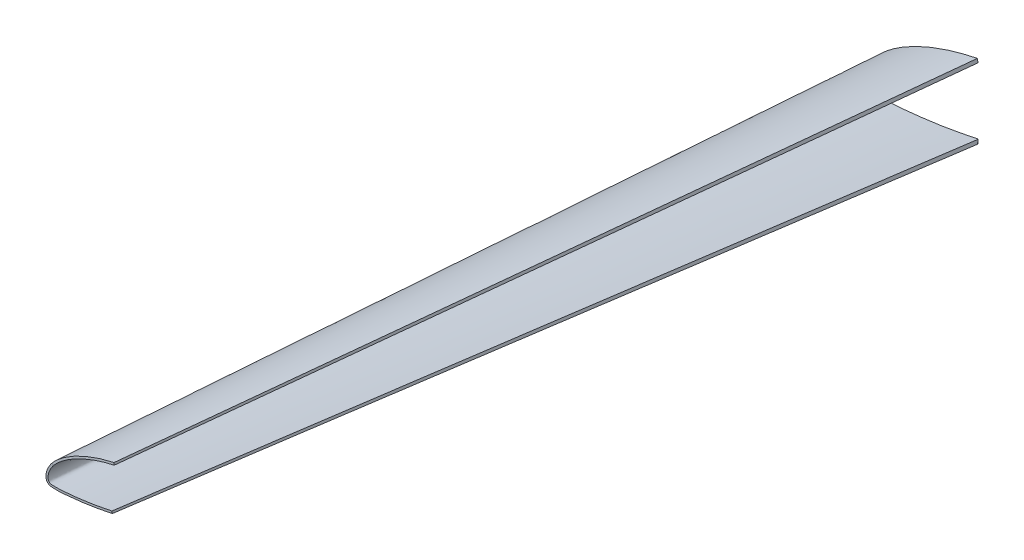
from build123d import *

# Parameters (mm, degrees)
CUT_EXTRUDE5_DEPTH      = 467.171820203
CUT_EXTRUDE5_DEPTH_BACK = 467.171820203


with BuildPart() as part:
    # Boundary1: read off the stored shape, not the designer's step
    # Boundary1: loft between two sections, ruled curve by curve
    boundary1_from = [
        Edge.make_bspline([(27.746461368, -10.231582557, -0.37970371), (24.54048865, -10.88648923, -0.3224068), (18.322219711, -12.153767625, -0.211534307), (9.311879161, -13.768668652, -0.070248775), (0.965035467, -14.962763473, 0.034220985), (-6.604009298, -15.908371944, 0.116951007), (-13.358041741, -16.623063146, 0.179478385), (-19.228055617, -17.091792561, 0.220486895), (-24.147885132, -17.37038488, 0.244860564), (-28.064249619, -17.286606019, 0.237530864), (-30.927663742, -17.184111401, 0.228563747), (-33.069779251, -16.204477975, 0.142856927), (-33.670245564, -14.180380357, -0.034228668), (-33.79784861, -11.966277347, -0.227937581), (-33.330465654, -9.339970934, -0.457709619), (-32.313062195, -6.487599721, -0.707259765), (-30.705815178, -3.476068737, -0.970734586), (-28.516579872, -0.373222201, -1.242198482), (-25.653586837, 2.727393202, -1.51346718), (-22.130293772, 5.79908064, -1.782205009), (-17.998850338, 8.874134437, -2.051237356), (-13.260099319, 11.888557643, -2.314965213), (-7.943462931, 14.801976598, -2.569856344), (-2.077633941, 17.581693253, -2.813050039), (4.319210231, 20.172647346, -3.03972915), (11.207289388, 22.560882395, -3.248672642), (19.047405598, 24.834293744, -3.447570363), (24.631685242, 26.123911427, -3.560397291), (27.746461368, 26.733720257, -3.61374865)], [0, 0, 0, 0, 0.069142211, 0.134093926, 0.193382849, 0.247272805, 0.29525533, 0.336863889, 0.371680257, 0.39933975, 0.419456898, 0.432512713, 0.445408835, 0.461295234, 0.479930086, 0.501308052, 0.525350586, 0.552013073, 0.581539338, 0.614461538, 0.650800476, 0.69040154, 0.733149242, 0.778919637, 0.827558387, 0.878968086, 0.932940996, 1, 1, 1, 1], 3),
        Edge.make_bspline([(27.360981111, 28.687716483, -3.784701168), (24.418912176, 28.111720153, -3.734308019), (18.568950334, 26.774993221, -3.617359566), (9.931603873, 24.271530826, -3.398334987), (1.454173497, 21.248858509, -3.133885426), (-6.825266824, 17.649092208, -2.818946683), (-13.476961936, 14.097742153, -2.508243813), (-18.595650936, 10.855460073, -2.224580887), (-22.295577191, 8.189990235, -1.991382494), (-25.829788091, 5.2796825, -1.736763559), (-29.147742681, 1.998580964, -1.449704371), (-31.555461477, -1.135032916, -1.175548681), (-33.181527352, -3.844071716, -0.938538497), (-34.240367025, -6.002821132, -0.749672395), (-35.079614705, -8.291167612, -0.54946802), (-35.557667228, -10.322301427, -0.371766837), (-35.732624245, -12.044184646, -0.221121576), (-35.721862376, -13.37712306, -0.104504575), (-35.582262474, -14.479538884, -0.008055688), (-35.368251029, -15.436490393, 0.07566672), (-35.0906666, -16.242838807, 0.146213065), (-34.612779787, -17.109226433, 0.222012161), (-33.836646855, -17.896788857, 0.290914945), (-33.042092756, -18.3852358, 0.333648515), (-32.003372281, -18.824617033, 0.372089392), (-30.818177722, -19.102451519, 0.39639676), (-29.490238689, -19.231378803, 0.407676436), (-28.340965262, -19.26258139, 0.410406308), (-26.85641179, -19.303547365, 0.413990367), (-24.952158992, -19.327749266, 0.416107759), (-22.656109383, -19.271609205, 0.41119614), (-20.398107438, -19.14823427, 0.400402231), (-18.167525907, -18.995496212, 0.387039383), (-15.192679466, -18.766498595, 0.367004687), (-11.479797979, -18.427372101, 0.337334964), (-7.040502934, -17.948902242, 0.295474275), (-2.6127621, -17.418521591, 0.249071981), (3.278252149, -16.651200192, 0.181940057), (10.649779589, -15.568979876, 0.087258048), (19.442358508, -13.958032163, -0.053681614), (25.243200231, -12.775750709, -0.157117839), (28.148011567, -12.182364396, -0.209032414)], [0, 0, 0, 0, 0.0625, 0.125, 0.1875, 0.25, 0.3125, 0.34375, 0.375, 0.40625, 0.4375, 0.46875, 0.484375, 0.5, 0.515625, 0.53125, 0.5390625, 0.546875, 0.5546875, 0.55859375, 0.5625, 0.56640625, 0.5703125, 0.57421875, 0.578125, 0.5859375, 0.59375, 0.6015625, 0.609375, 0.625, 0.640625, 0.65625, 0.671875, 0.6875, 0.71875, 0.75, 0.78125, 0.8125, 0.875, 0.9375, 1, 1, 1, 1], 3),
        Edge.make_line((28.148011567, -12.182364396, -0.209032414), (27.746461368, -10.231582557, -0.37970371)),
        Edge.make_line((27.746461368, 26.733720257, -3.61374865), (27.360981111, 28.687716483, -3.784701168)),
    ]
    boundary1_to = [
        Edge.make_bspline([(1.183457689, 25.927911818, 461.777436147), (-0.686693063, 25.545882925, 461.810859344), (-4.314016611, 24.806637194, 461.875534965), (-9.570048598, 23.864611595, 461.957951526), (-14.439040753, 23.168056283, 462.018892219), (-18.854316866, 22.616451342, 462.067151398), (-22.794169125, 22.199548141, 462.103625702), (-26.218343885, 21.926122649, 462.127547333), (-29.088244436, 21.763610462, 462.141765307), (-31.372790386, 21.812481465, 462.137489648), (-33.043115292, 21.872269991, 462.13225883), (-34.292682672, 22.443722824, 462.082263185), (-34.642954688, 23.624446434, 461.978963255), (-34.717389798, 24.916006523, 461.865966388), (-34.44474974, 26.448018598, 461.7319327), (-33.851264389, 28.111901805, 461.586361781), (-32.913703629, 29.868628212, 461.432668136), (-31.636649701, 31.678622025, 461.274314196), (-29.96657043, 33.487314343, 461.116074123), (-27.911316142, 35.279132015, 460.959310389), (-25.501307472, 37.072913397, 460.802374853), (-22.737036045, 38.831326934, 460.648533603), (-19.635664819, 40.530821325, 460.49984711), (-16.213931241, 42.152322706, 460.357984121), (-12.482438807, 43.663712594, 460.22575464), (-8.464392632, 45.056849706, 460.103870936), (-3.89099151, 46.383006326, 459.987847266), (-0.633495051, 47.135283308, 459.922031558), (1.183457689, 47.491005126, 459.890909932)], [0, 0, 0, 0, 0.069142211, 0.134093926, 0.193382849, 0.247272805, 0.29525533, 0.336863889, 0.371680257, 0.39933975, 0.419456898, 0.432512713, 0.445408835, 0.461295234, 0.479930086, 0.501308052, 0.525350586, 0.552013073, 0.581539338, 0.614461538, 0.650800476, 0.69040154, 0.733149242, 0.778919637, 0.827558387, 0.878968086, 0.932940996, 1, 1, 1, 1], 3),
        Edge.make_bspline([(0.958594206, 48.630836257, 459.791187629), (-0.757612673, 48.294838398, 459.820583633), (-4.170090414, 47.515081021, 459.888803564), (-9.208542516, 46.054727957, 460.016567902), (-14.153710236, 44.291502439, 460.170830146), (-18.983383756, 42.191638763, 460.354544412), (-22.863539238, 40.120017898, 460.535787753), (-25.849441155, 38.228686685, 460.701257793), (-28.00773147, 36.673829279, 460.83729019), (-30.069354495, 34.976149767, 460.985817901), (-32.004828006, 33.062173871, 461.153269094), (-33.409330637, 31.234232441, 461.313193247), (-34.357869064, 29.653959808, 461.451449188), (-34.97552554, 28.394689315, 461.56162108), (-35.465086687, 27.059820535, 461.678406966), (-35.743950659, 25.874992476, 461.782065989), (-35.846008918, 24.870560599, 461.869942392), (-35.839731162, 24.093013191, 461.937968975), (-35.758297885, 23.449937293, 461.994230826), (-35.633457875, 22.89171558, 462.043068898), (-35.471533625, 22.421345671, 462.084220932), (-35.192766318, 21.91595289, 462.128437071), (-34.740022107, 21.456541476, 462.168630362), (-34.276532216, 21.171614092, 462.193558278), (-33.67061194, 20.915308373, 462.215982123), (-32.979248447, 20.753238256, 462.230161421), (-32.204617344, 20.678030674, 462.236741232), (-31.534207845, 20.659829165, 462.238333657), (-30.668218319, 20.635932346, 462.240424358), (-29.557404187, 20.62181457, 462.241659503), (-28.218041916, 20.654562939, 462.238794392), (-26.900874114, 20.726531652, 462.232497946), (-25.599701555, 20.815628852, 462.224702951), (-23.864374464, 20.949210795, 462.213016045), (-21.69852693, 21.147034583, 462.195708706), (-19.108938154, 21.426142001, 462.171289971), (-16.526089334, 21.735530714, 462.144221966), (-13.089664355, 22.183134864, 462.105061678), (-8.789606682, 22.814430048, 462.049830506), (-3.660602312, 23.754149547, 461.967615702), (-0.276777974, 24.443813728, 461.907277905), (1.417695305, 24.789955744, 461.876994403)], [0, 0, 0, 0, 0.0625, 0.125, 0.1875, 0.25, 0.3125, 0.34375, 0.375, 0.40625, 0.4375, 0.46875, 0.484375, 0.5, 0.515625, 0.53125, 0.5390625, 0.546875, 0.5546875, 0.55859375, 0.5625, 0.56640625, 0.5703125, 0.57421875, 0.578125, 0.5859375, 0.59375, 0.6015625, 0.609375, 0.625, 0.640625, 0.65625, 0.671875, 0.6875, 0.71875, 0.75, 0.78125, 0.8125, 0.875, 0.9375, 1, 1, 1, 1], 3),
        Edge.make_line((1.417695305, 24.789955744, 461.876994403), (1.183457689, 25.927911818, 461.777436147)),
        Edge.make_line((1.183457689, 47.491005126, 459.890909932), (0.958594206, 48.630836257, 459.791187629)),
    ]
    boundary1 = Solid(Shell([*[Face.make_surface_from_curves(boundary1_from[k], boundary1_to[k]) for k in range(4)], Face(Wire(boundary1_from)), Face(Wire(boundary1_to))]))
    add(boundary1)

    # Sketch5 → Cut-Extrude5 (cut, two sides: drawn at the far end of the back side and taken through both)
    with BuildSketch(Plane(origin=(0, 0, 0), x_dir=(1, 0, 0), z_dir=(0, 1, 0)).offset(-CUT_EXTRUDE5_DEPTH_BACK)):
        Polygon((-35.721546653, -0.413960836), (27.474589662, -0.413960836), (28.624276546, -1.901938856), (28.624276546, 5.514944665), (-37.390121525, 5.514944665), (-37.390121525, -0.413960836), align=None)
        Polygon((-35.721546653, -467.169587901), (27.474589662, -467.169587901), (28.624276546, -468.657565921), (28.624276546, -461.2406824), (-37.390121525, -461.2406824), (-37.390121525, -467.169587901), align=None)
    extrude(amount=CUT_EXTRUDE5_DEPTH + CUT_EXTRUDE5_DEPTH_BACK, mode=Mode.SUBTRACT)


solid = part.part
